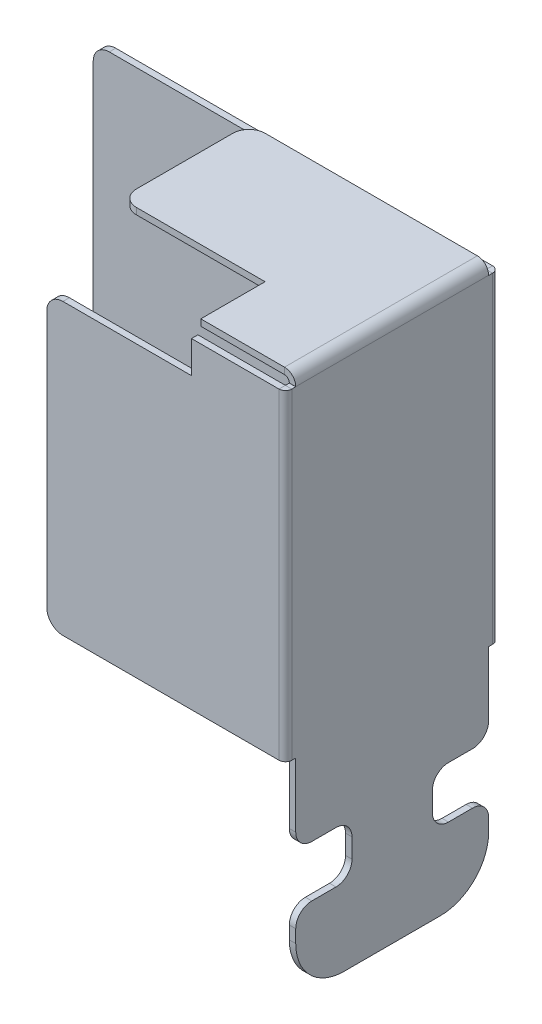
from build123d import *

# Parameters (mm, degrees)
SKETCH1_R                   = 1.6
BASE_FLANGE1_DEPTH          = 0.4
SKETCHED_START              = 45.702497433
SKETCHED_BEND8_DEPTH        = 12
SKETCHED_BEND8_2_DEPTH      = 8
SKETCHED_START_2            = 53.702497433
SKETCHED_BEND8_3_DEPTH      = 4
SKETCHED_START_3            = -0.4
SKETCHED_BEND12_OUTLINE_W   = 12
SKETCHED_BEND12_OUTLINE_H   = 0.4
SKETCHED_BEND12_DEPTH       = 14.907300918
SKETCHED_START_4            = 0.242920367
SKETCHED_BEND12_2_OUTLINE_W = 0.4
SKETCHED_BEND12_2_OUTLINE_H = 4.8
SKETCHED_BEND12_2_DEPTH     = 12
SKETCHED_START_5            = 12.485840735
SKETCHED_BEND12_3_DEPTH     = 0.4
SKETCHED_BEND12_4_OUTLINE_W = 9
SKETCHED_BEND12_4_OUTLINE_H = 0.4
SKETCHED_BEND12_4_DEPTH     = 8
SKETCHED_START_6            = 3.742920367
SKETCHED_BEND12_5_OUTLINE_W = 0.4
SKETCHED_BEND12_5_OUTLINE_H = 3.2
SKETCHED_BEND12_5_DEPTH     = 5
SKETCHED_BEND12_6_OUTLINE_W = 0.4
SKETCHED_BEND12_6_OUTLINE_H = 20
SKETCHED_BEND12_6_DEPTH     = 12.485840735
SKETCHED_START_7            = -4.042672779
SKETCHED_BEND12_7_DEPTH     = 33.307300919
SKETCHED_START_8            = 8.957327221
SKETCHED_BEND12_8_DEPTH     = 20
FILLET1_R                   = 3
FILLET2_R                   = 1
FILLET3_R                   = 1


with BuildPart() as part:
    # Base-Flange1: sheet metal written as solids
    # Sketch1 → Base-Flange1 (new body)
    with BuildSketch(Plane.XY):
        Polygon((30.702497433, -1.042672779), (30.702497433, 8.957327221), (45.702497433, 8.957327221), (45.702497433, 3.957327221), (49.202497433, 3.957327221), (49.202497433, 0.757327221), (45.702497433, 0.757327221), (45.702497433, -4.042672779), (57.702497433, -4.042672779), (57.702497433, 0.757327221), (54.202497433, 0.757327221), (54.202497433, 3.957327221), (57.702497433, 3.957327221), (57.702497433, 8.957327221), (72.702497433, 8.957327221), (72.702497433, 26.957327221), (63.702497433, 26.957327221), (63.702497433, 28.957327221), (57.702497433, 28.957327221), (57.702497433, 34.957327221), (53.702497433, 34.957327221), (53.702497433, 43.957327221), (45.702497433, 43.957327221), (45.702497433, 28.957327221), (20.702497433, 28.957327221), (20.702497433, -1.042672779), align=None)
        with Locations((25.702497433, 3.957327221)):
            Circle(SKETCH1_R, mode=Mode.SUBTRACT)
    extrude(amount=-BASE_FLANGE1_DEPTH)

    # Sketched Bend8: read off the stored shape, not the designer's step
    # Sketched Bend8 outline → Sketched Bend8 (cut)
    with BuildSketch(Plane.YZ.offset(SKETCHED_START)):
        with BuildLine():
            ThreePointArc((29.597083672, 0), (29.338793878, -0.291607978), (28.96462814, -0.4))
            Line((28.96462814, -0.4), (43.957327221, -0.4))
            Line((43.957327221, -0.4), (43.957327221, 0))
            Line((43.957327221, 0), (29.597083672, 0))
        make_face()
    extrude(amount=SKETCHED_BEND8_DEPTH, mode=Mode.SUBTRACT)

    # Sketched Bend8 2 outline → Sketched Bend8 2 (add)
    with BuildSketch(Plane.YZ.offset(SKETCHED_START)):
        with BuildLine():
            Line((29.66462814, 14.507300918), (29.26462814, 14.507300918))
            Line((29.26462814, 14.507300918), (29.26462814, 0.3))
            ThreePointArc((29.26462814, 0.3), (29.176760174, 0.087867966), (28.96462814, 0))
            Line((28.96462814, 0), (29.597083672, 0))
            ThreePointArc((29.597083672, 0), (29.647533284, 0.146245118), (29.66462814, 0.3))
            Line((29.66462814, 0.3), (29.66462814, 14.507300918))
        make_face()
    extrude(amount=SKETCHED_BEND8_2_DEPTH)

    # Sketched Bend8 3 outline → Sketched Bend8 3 (add)
    with BuildSketch(Plane.YZ.offset(SKETCHED_START_2)):
        with BuildLine():
            Line((29.66462814, 0.3), (29.66462814, 5.507300918))
            Line((29.66462814, 5.507300918), (29.26462814, 5.507300918))
            Line((29.26462814, 5.507300918), (29.26462814, 0.3))
            ThreePointArc((29.26462814, 0.3), (29.176760174, 0.087867966), (28.96462814, 0))
            Line((28.96462814, 0), (29.597083672, 0))
            ThreePointArc((29.597083672, 0), (29.647533284, 0.146245118), (29.66462814, 0.3))
        make_face()
    extrude(amount=SKETCHED_BEND8_3_DEPTH)

    # Sketched Bend12: read off the stored shape, not the designer's step
    # Sketched Bend12 outline → Sketched Bend12 (cut)
    with BuildSketch(Plane.XY.offset(SKETCHED_START_3)):
        with Locations((51.702497433, 29.46462814)):
            Rectangle(SKETCHED_BEND12_OUTLINE_W, SKETCHED_BEND12_OUTLINE_H)
    extrude(amount=SKETCHED_BEND12_DEPTH, mode=Mode.SUBTRACT)



with BuildPart() as body_2:
    # Sketched Bend12 2 outline → Sketched Bend12 2 (new body)
    with BuildSketch(Plane.XY.offset(SKETCHED_START_4)):
        with BuildLine():
            ThreePointArc((45.545417801, 28.96462814), (45.340392547, 29.459602886), (44.845417801, 29.66462814))
            Line((44.845417801, 29.66462814), (39.638116882, 29.66462814))
            Line((39.638116882, 29.66462814), (39.638116882, 29.26462814))
            Line((39.638116882, 29.26462814), (44.845417801, 29.26462814))
            ThreePointArc((44.845417801, 29.26462814), (45.057549835, 29.176760174), (45.145417801, 28.96462814))
            Line((45.145417801, 28.96462814), (45.145417801, 3.957327221))
            Line((45.145417801, 3.957327221), (45.545417801, 3.957327221))
            Line((45.545417801, 3.957327221), (45.545417801, 28.96462814))
        make_face()
        with Locations((45.345417801, -1.642672779)):
            Rectangle(SKETCHED_BEND12_2_OUTLINE_W, SKETCHED_BEND12_2_OUTLINE_H)
    extrude(amount=SKETCHED_BEND12_2_DEPTH)

    # Sketched Bend12 4 outline → Sketched Bend12 4 (add)
    with BuildSketch(Plane.XY.offset(SKETCHED_START_4)):
        with Locations((35.138116882, 29.46462814)):
            Rectangle(SKETCHED_BEND12_4_OUTLINE_W, SKETCHED_BEND12_4_OUTLINE_H)
    extrude(amount=SKETCHED_BEND12_4_DEPTH)

    # Sketched Bend12 5 outline → Sketched Bend12 5 (add)
    with BuildSketch(Plane.XY.offset(SKETCHED_START_6)):
        with Locations((45.345417801, 2.357327221)):
            Rectangle(SKETCHED_BEND12_5_OUTLINE_W, SKETCHED_BEND12_5_OUTLINE_H)
    extrude(amount=SKETCHED_BEND12_5_DEPTH)


with BuildPart() as body_3:
    # Sketched Bend12 3 outline → Sketched Bend12 3 (new body)
    with BuildSketch(Plane.XY.offset(SKETCHED_START_5)):
        Polygon((45.145417801, 8.957327221), (45.145417801, 28.957327221), (39.702497433, 28.957327221), (39.702497433, 26.957327221), (30.702497433, 26.957327221), (30.702497433, 8.957327221), align=None)
    extrude(amount=SKETCHED_BEND12_3_DEPTH)


with BuildPart() as part_1:
    add(part.part)

    add(body_2.part)  # Sketched Bend12 6 merges body 2

    add(body_3.part)  # Sketched Bend12 6 merges body 3
    # Sketched Bend12 6 outline → Sketched Bend12 6 (add)
    with BuildSketch(Plane.XY):
        with Locations((45.345417801, 18.957327221)):
            Rectangle(SKETCHED_BEND12_6_OUTLINE_W, SKETCHED_BEND12_6_OUTLINE_H)
    extrude(amount=SKETCHED_BEND12_6_DEPTH)

    # Sketched Bend12 7 outline → Sketched Bend12 7 (cut)
    with BuildSketch(Plane(origin=(0, 0, 0), x_dir=(1, 0, 0), z_dir=(0, 1, 0)).offset(SKETCHED_START_7)):
        with BuildLine():
            ThreePointArc((45.145417801, 0.4), (45.428260513, 0.282842712), (45.545417801, 0))
            Line((45.545417801, 0), (45.702497433, 0))
            Line((45.702497433, 0), (45.702497433, -14))
            Line((45.702497433, -14), (57.702497433, -14))
            Line((57.702497433, -14), (57.702497433, 0))
            Line((57.702497433, 0), (72.702497433, 0))
            Line((72.702497433, 0), (72.702497433, 0.4))
            Line((72.702497433, 0.4), (45.145417801, 0.4))
        make_face()
    extrude(amount=SKETCHED_BEND12_7_DEPTH, mode=Mode.SUBTRACT)

    # Sketched Bend12 8 outline → Sketched Bend12 8 (add)
    with BuildSketch(Plane(origin=(0, 0, 0), x_dir=(1, 0, 0), z_dir=(0, 1, 0)).offset(SKETCHED_START_8)):
        with BuildLine():
            Line((45.145417801, -12.485840735), (45.145417801, -12.885840735))
            ThreePointArc((45.145417801, -12.885840735), (45.428260513, -12.768683447), (45.545417801, -12.485840735))
            Line((45.545417801, -12.485840735), (45.145417801, -12.485840735))
        make_face()
    extrude(amount=SKETCHED_BEND12_8_DEPTH)

    # Fillet1
    fillet1_edges = [part_1.edges().sort_by_distance(p)[0] for p in [
        (45.345417801, -4.042672779, 0.242920367),
        (45.345417801, -4.042672779, 12.242920367),
        (30.702497433, -1.042672779, -0.2),
        (20.702497433, -1.042672779, -0.2),
    ]]
    fillet(fillet1_edges, radius=FILLET1_R)

    # Fillet2
    fillet2_edges = [part_1.edges().sort_by_distance(p)[0] for p in [
        (20.702497433, 28.957327221, -0.2),
        (30.702497433, 26.957327221, 12.685840735),
        (30.702497433, 8.957327221, 12.685840735),
        (30.638116882, 29.46462814, 0.242920367),
        (30.638116882, 29.46462814, 8.242920367),
    ]]
    fillet(fillet2_edges, radius=FILLET2_R)

    # Fillet3
    fillet3_edges = [part_1.edges().sort_by_distance(p)[0] for p in [
        (45.345417801, 3.957327221, 0.242920367),
        (45.345417801, 3.957327221, 3.742920367),
        (45.345417801, 0.757327221, 3.742920367),
        (45.345417801, 0.757327221, 0.242920367),
        (45.345417801, 0.757327221, 12.242920367),
        (45.345417801, 0.757327221, 8.742920367),
        (45.345417801, 3.957327221, 8.742920367),
        (45.345417801, 3.957327221, 12.242920367),
    ]]
    fillet(fillet3_edges, radius=FILLET3_R)


solid = part_1.part
